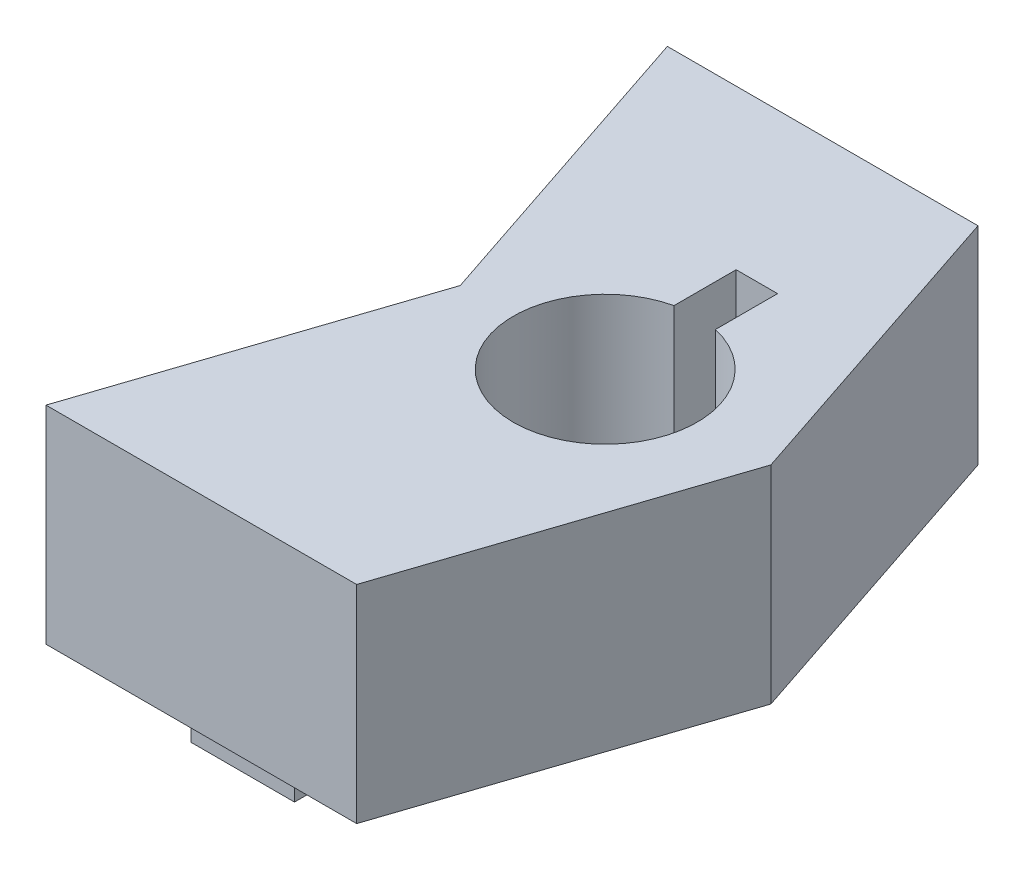
from build123d import *

# Parameters (mm, degrees)
BOSS_EXTRUDE1_DEPTH       = 12.7
SKETCH2_R                 = 5.635000033
HAPTIC_MOTOR_CUTOUT_DEPTH = 9.557999934
SKETCH3_W                 = 2.54
SKETCH3_H                 = 3.81
HAPTIC_WIRE_CUTOUT_DEPTH  = 48.519048812
SKETCH4_W                 = 6.35
SKETCH4_H                 = 2.54
PINS_DEPTH                = 2.032


with BuildPart() as part:
    # Sketch1 → Boss-Extrude1 (new body)
    with BuildSketch(Plane(origin=(0, 0, 0), x_dir=(1, 0, 0), z_dir=(0, 1, 0))):
        Polygon((0, 0), (19.05, 0), (25.4, 19.05), (19.05, 38.1), (0, 38.1), (6.35, 19.05), align=None)
    extrude(amount=BOSS_EXTRUDE1_DEPTH)

    # Sketch2 → Haptic Motor Cutout (cut)
    with BuildSketch(Plane.XZ.offset(-12.7)):
        with Locations((15.24, -19.05)):
            Circle(SKETCH2_R)
    extrude(amount=HAPTIC_MOTOR_CUTOUT_DEPTH, mode=Mode.SUBTRACT)

    # Sketch3 → Haptic Wire Cutout (cut, through all)
    with BuildSketch(Plane.XZ):
        with Locations((15.24, -26.445020526)):
            Rectangle(SKETCH3_W, SKETCH3_H)
    extrude(amount=-HAPTIC_WIRE_CUTOUT_DEPTH, mode=Mode.SUBTRACT)

    # Sketch4 → Pins (add)
    with BuildSketch(Plane.XZ):
        with Locations((10.795, -35.56)):
            Rectangle(SKETCH4_W, SKETCH4_H)
    pins = extrude(amount=PINS_DEPTH)

    # Mirror1: Pins across plane
    add(pins.mirror(Plane(origin=(0, 0, -19.05), x_dir=(1, 0, 0), z_dir=(0, 0, -1))))


solid = part.part
